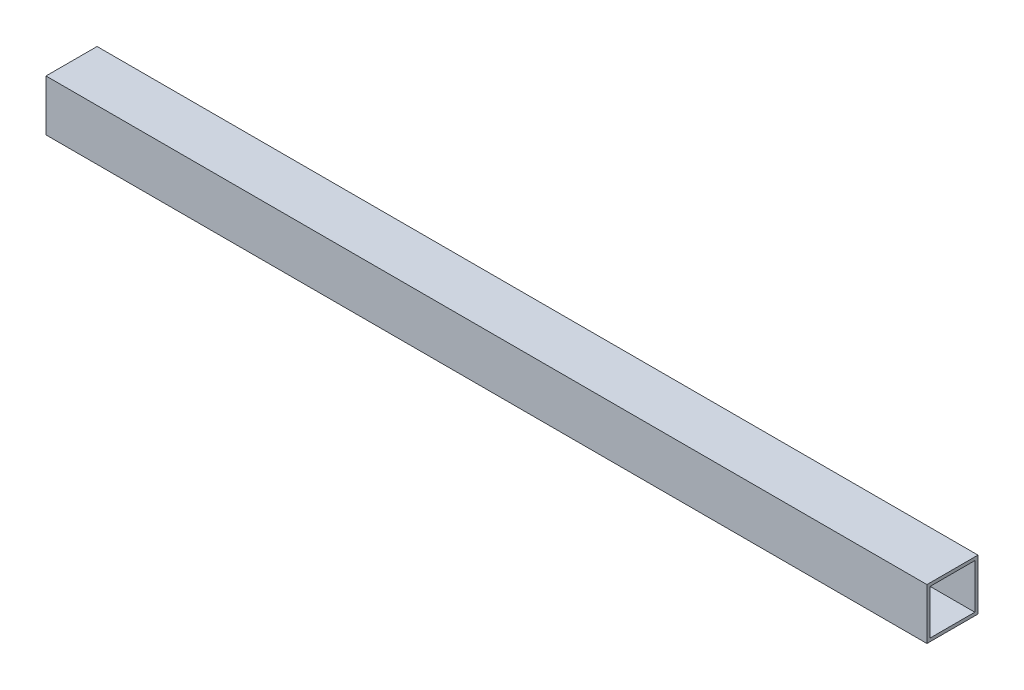
from build123d import *

# Parameters (mm, degrees)
BOSS_EXTRUDE1_DEPTH      = 438.15
BOSS_EXTRUDE1_DEPTH_BACK = 438.15
SKETCH1_W                = 50.8
SKETCH1_H                = 50.8
SKETCH1_W_2              = 44.45
SKETCH1_H_2              = 44.45


with BuildPart() as part:
    # Sketch1 → Boss-Extrude1 (new, two sides: drawn at the far end of the back side and taken through both)
    with BuildSketch(Plane(origin=(0, 0, 0), x_dir=(0, 0, -1), z_dir=(1, 0, 0)).offset(-BOSS_EXTRUDE1_DEPTH_BACK)):
        with Locations((25.4, 25.4)):
            Rectangle(SKETCH1_W, SKETCH1_H)
        with Locations((25.4, 25.4)):
            Rectangle(SKETCH1_W_2, SKETCH1_H_2, mode=Mode.SUBTRACT)
    extrude(amount=BOSS_EXTRUDE1_DEPTH + BOSS_EXTRUDE1_DEPTH_BACK)


solid = part.part
